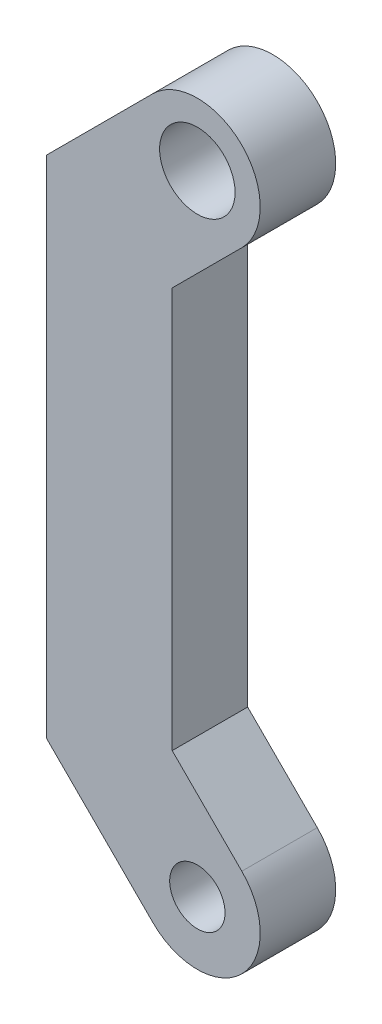
from build123d import *

# Parameters (mm, degrees)
CROQUIS1_R              = 1.1
CROQUIS1_R_2            = 1.5
SALIENTE_EXTRUIR1_DEPTH = 3


with BuildPart() as part:
    # Croquis1 → Saliente-Extruir1 (new body)
    with BuildSketch(Plane.XY):
        with BuildLine():
            Line((-6, 2.464466094), (-1.767766953, -1.767766953))
            ThreePointArc((-1.767766953, -1.767766953), (1.767766953, -1.767766953), (1.767766953, 1.767766953))
            Line((1.767766953, 1.767766953), (-1, 4.535533906))
            Line((-1, 4.535533906), (-1, 20.464466094))
            Line((-1, 20.464466094), (1.767766953, 23.232233047))
            ThreePointArc((1.767766953, 23.232233047), (1.767766953, 26.767766953), (-1.767766953, 26.767766953))
            Line((-1.767766953, 26.767766953), (-6, 22.535533906))
            Line((-6, 22.535533906), (-6, 2.464466094))
        make_face()
        Circle(CROQUIS1_R, mode=Mode.SUBTRACT)
        with Locations((0, 25)):
            Circle(CROQUIS1_R_2, mode=Mode.SUBTRACT)
    extrude(amount=SALIENTE_EXTRUIR1_DEPTH)


solid = part.part
